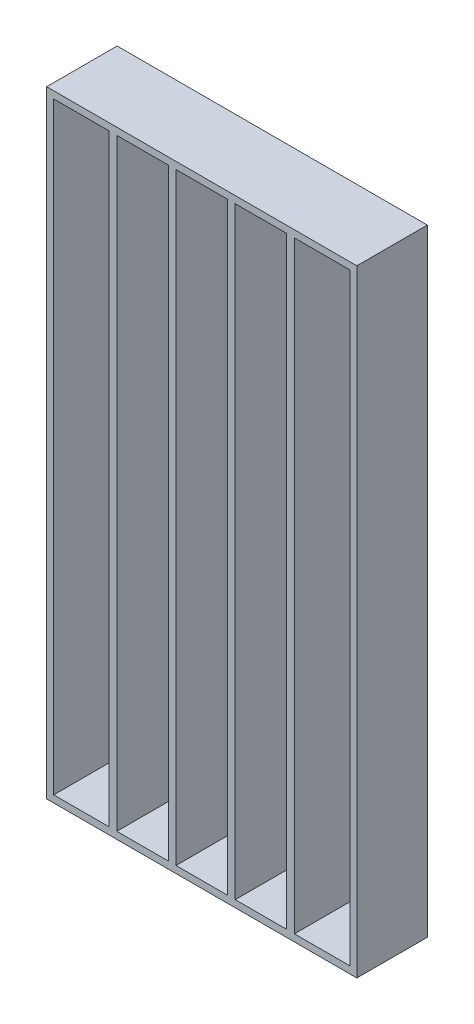
from build123d import *

# Parameters (mm, degrees)
SKETCH1_W           = 88
SKETCH1_H           = 175
BOSS_EXTRUDE1_DEPTH = 2
SKETCH2_W           = 88
SKETCH2_H           = 175
SKETCH2_W_2         = 84
SKETCH2_H_2         = 171
EXTRUDE_THIN1_DEPTH = 18
SKETCH3_W           = 2.2
SKETCH3_H           = 171
EXTRUDE_THIN2_DEPTH = 18


with BuildPart() as part:
    # Sketch1 → Boss-Extrude1 (new body)
    with BuildSketch(Plane.XY):
        Rectangle(SKETCH1_W, SKETCH1_H)
    extrude(amount=BOSS_EXTRUDE1_DEPTH)

    # Sketch2 → Extrude-Thin1 (add)
    with BuildSketch(Plane.XY.offset(2)):
        Rectangle(SKETCH2_W, SKETCH2_H)
        Rectangle(SKETCH2_W_2, SKETCH2_H_2, mode=Mode.SUBTRACT)
    extrude(amount=EXTRUDE_THIN1_DEPTH)

    # Sketch3 → Extrude-Thin2 (add)
    with BuildSketch(Plane.XY.offset(2)):
        with Locations((-25.2, 0)):
            Rectangle(SKETCH3_W, SKETCH3_H)
        with Locations((-8.4, 0)):
            Rectangle(SKETCH3_W, SKETCH3_H)
        with Locations((25.2, 0)):
            Rectangle(SKETCH3_W, SKETCH3_H)
        with Locations((8.4, 0)):
            Rectangle(SKETCH3_W, SKETCH3_H)
    extrude(amount=EXTRUDE_THIN2_DEPTH)


solid = part.part
